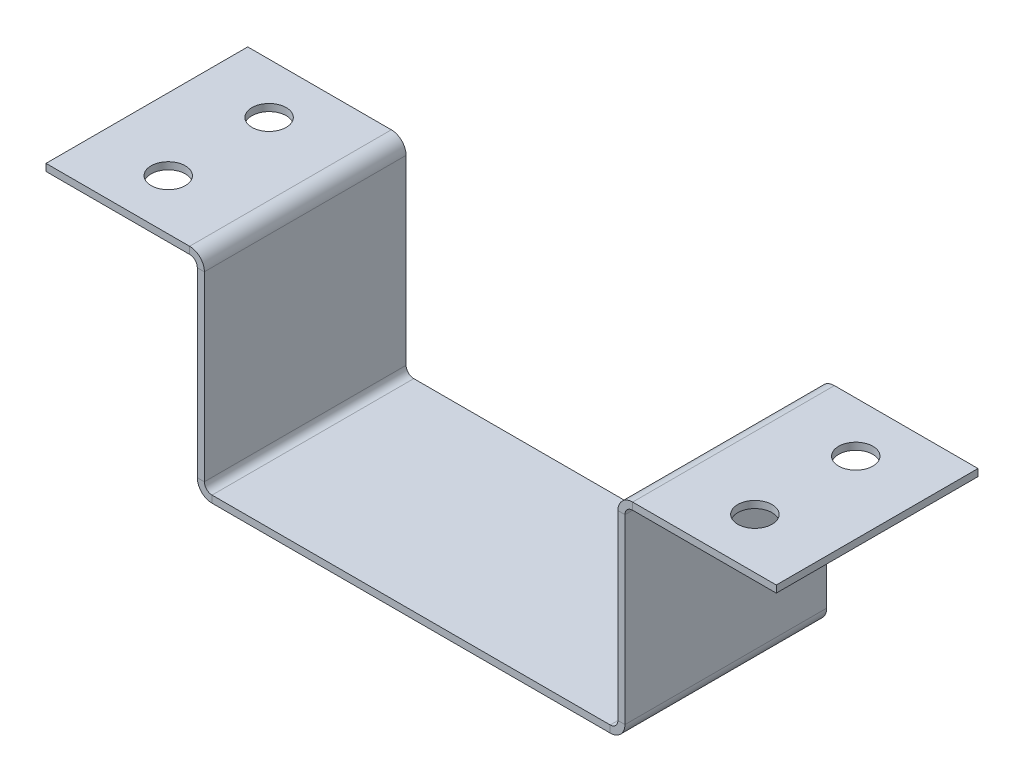
from build123d import *

# Parameters (mm, degrees)
SKETCH1_W                    = 41
SKETCH1_H                    = 20
BASE_FLANGE1_DEPTH           = 0.7
EDGE_FLANGE1_STRIP_W         = 4.324
EDGE_FLANGE1_STRIP_H         = 0.7
EDGE_FLANGE1_STRIP_CUT_DEPTH = 20
EDGE_FLANGE1_DEPTH           = 20
EDGE_FLANGE2_STRIP_W         = 4.324
EDGE_FLANGE2_STRIP_H         = 0.7
EDGE_FLANGE2_STRIP_CUT_DEPTH = 20
EDGE_FLANGE2_DEPTH           = 20
M3_CLEARANCE_HOLE1_D         = 3.4


# Sheet-metal steps are written as plain solids
with BuildPart() as part:
    # Sketch1 → Base-Flange1 (new body)
    with BuildSketch(Plane(origin=(0, 0, 0), x_dir=(1, 0, 0), z_dir=(0, 1, 0))):
        with Locations((20.5, 10)):
            Rectangle(SKETCH1_W, SKETCH1_H)
    extrude(amount=-BASE_FLANGE1_DEPTH)

    # Edge-Flange1 strip (across the edge) → Edge-Flange1 strip cut (cut)
    with BuildSketch(Plane(origin=(41, 0, 0), x_dir=(-1, 0, 0), z_dir=(0, 0, -1))):
        with Locations((-1.4, -0.35)):
            Rectangle(EDGE_FLANGE1_STRIP_W, EDGE_FLANGE1_STRIP_H)
    edge_flange1_strip_cut = extrude(amount=EDGE_FLANGE1_STRIP_CUT_DEPTH, mode=Mode.SUBTRACT)

    # Edge-Flange1 section (across the edge) → Edge-Flange1 (add)
    with BuildSketch(Plane(origin=(41, 0, 0), x_dir=(-1, 0, 0), z_dir=(0, 0, -1))):
        with BuildLine():
            Line((-0.7, 0.762), (-0.7, 20.25))
            Line((-0.7, 20.25), (0, 20.25))
            Line((0, 20.25), (0, 0.762))
            ThreePointArc((0, 0.762), (0.223184633, 0.223184633), (0.762, 0))
            Line((0.762, 0), (0.762, -0.7))
            ThreePointArc((0.762, -0.7), (-0.271790114, -0.271790114), (-0.7, 0.762))
        make_face()
    edge_flange1 = extrude(amount=EDGE_FLANGE1_DEPTH)

    # Edge-Flange2 strip (across the edge) → Edge-Flange2 strip cut (cut)
    with BuildSketch(Plane(origin=(41.7, 20.25, -20), x_dir=(0, -1, 0), z_dir=(0, 0, 1))):
        with Locations((-0.7, -0.35)):
            Rectangle(EDGE_FLANGE2_STRIP_W, EDGE_FLANGE2_STRIP_H)
    edge_flange2_strip_cut = extrude(amount=EDGE_FLANGE2_STRIP_CUT_DEPTH, mode=Mode.SUBTRACT)

    # Edge-Flange2 section (across the edge) → Edge-Flange2 (add)
    with BuildSketch(Plane(origin=(41.7, 20.25, -20), x_dir=(0, -1, 0), z_dir=(0, 0, 1))):
        with BuildLine():
            Line((0, 0.762), (0, 15))
            Line((0, 15), (0.7, 15))
            Line((0.7, 15), (0.7, 0.762))
            ThreePointArc((0.7, 0.762), (0.923184633, 0.223184633), (1.462, 0))
            Line((1.462, 0), (1.462, -0.7))
            ThreePointArc((1.462, -0.7), (0.428209886, -0.271790114), (0, 0.762))
        make_face()
    edge_flange2 = extrude(amount=EDGE_FLANGE2_DEPTH)

    # Mirror1: Edge-Flange1 strip cut, Edge-Flange1, Edge-Flange2 strip cut, Edge-Flange2 across plane
    add(edge_flange1_strip_cut.mirror(Plane(origin=(20.5, 0, 0), x_dir=(0, 0, 1), z_dir=(1, 0, 0))), mode=Mode.SUBTRACT)
    add(edge_flange1.mirror(Plane(origin=(20.5, 0, 0), x_dir=(0, 0, 1), z_dir=(1, 0, 0))))
    add(edge_flange2_strip_cut.mirror(Plane(origin=(20.5, 0, 0), x_dir=(0, 0, 1), z_dir=(1, 0, 0))), mode=Mode.SUBTRACT)
    add(edge_flange2.mirror(Plane(origin=(20.5, 0, 0), x_dir=(0, 0, 1), z_dir=(1, 0, 0))))

    # M3 Clearance Hole1 (through all)
    with Locations(Plane(origin=(0, 20.25, 0), x_dir=(1, 0, 0), z_dir=(0, 1, 0))):
        with Locations((49.581, 15), (49.581, 5), (-8.581, 15), (-8.581, 5)):
            Hole(M3_CLEARANCE_HOLE1_D / 2)


solid = part.part
